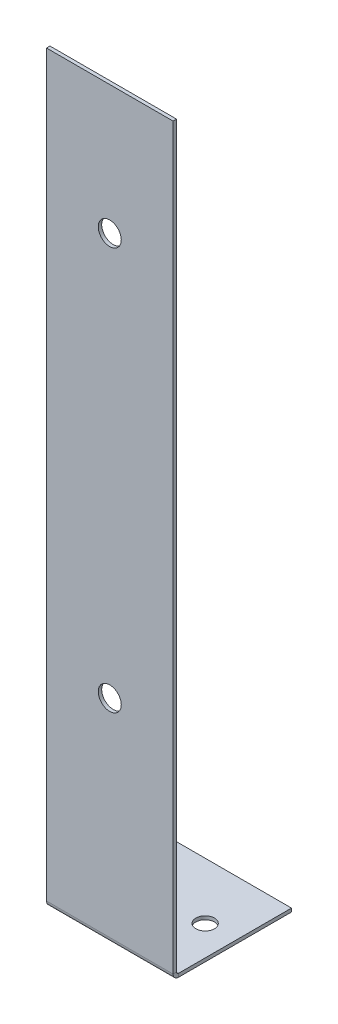
from build123d import *

# Parameters (mm, degrees)
SKETCH1_W              = 44
SKETCH1_H              = 300
BASE_FLANGE1_DEPTH     = 1.2
SKETCHED_START         = -22
SKETCHED_BEND1_DEPTH   = 44
SKETCHED_BEND1_2_DEPTH = 44
SKETCH7_R              = 4
CUT_EXTRUDE1_DEPTH     = 10
SKETCH9_R              = 3.234304459
CUT_EXTRUDE2_DEPTH     = 10


# Read off the part's stored shape, not the designer's step: Sketched Bend1
# Sheet-metal steps are written as plain solids
with BuildPart() as part:
    # Sketch1 → Base-Flange1 (new body)
    with BuildSketch(Plane(origin=(0, 0, 0), x_dir=(1, 0, 0), z_dir=(0, 1, 0))):
        Rectangle(SKETCH1_W, SKETCH1_H)
    extrude(amount=-BASE_FLANGE1_DEPTH)

    # Sketched Bend1 outline → Sketched Bend1 (cut)
    with BuildSketch(Plane.YZ.offset(SKETCHED_START)):
        with BuildLine():
            ThreePointArc((-1.2, -110.7366), (-0.872269031, -109.658657516), (0, -108.945555612))
            Line((0, -108.945555612), (0, 150))
            Line((0, 150), (-1.2, 150))
            Line((-1.2, 150), (-1.2, -110.7366))
        make_face()
    extrude(amount=SKETCHED_BEND1_DEPTH, mode=Mode.SUBTRACT)

    # Sketched Bend1 2 outline → Sketched Bend1 2 (add)
    with BuildSketch(Plane.YZ.offset(SKETCHED_START)):
        with BuildLine():
            Line((257.6, -110), (257.6, -108.8))
            Line((257.6, -108.8), (0.7366, -108.8))
            ThreePointArc((0.7366, -108.8), (0.361178238, -108.836737358), (0, -108.945555612))
            Line((0, -108.945555612), (0, -110.7366))
            ThreePointArc((0, -110.7366), (0.215745145, -110.215745145), (0.7366, -110))
            Line((0.7366, -110), (257.6, -110))
        make_face()
    extrude(amount=SKETCHED_BEND1_2_DEPTH)

    # Sketch7 → Cut-Extrude1 (cut)
    with BuildSketch(Plane.XY.offset(-108.8)):
        with Locations((0, 72.8)):
            Circle(SKETCH7_R)
        with Locations((0, 212.8)):
            Circle(SKETCH7_R)
    extrude(amount=-CUT_EXTRUDE1_DEPTH, mode=Mode.SUBTRACT)

    # Sketch9 → Cut-Extrude2 (cut)
    with BuildSketch(Plane.XZ.offset(1.2)):
        with Locations(Location((-11.601340887, -130.3683, 0), (0, 0, 270))):
            Circle(SKETCH9_R)
        with Locations(Location((11.601340887, -130.3683, 0), (0, 0, 270))):
            Circle(SKETCH9_R)
    extrude(amount=-CUT_EXTRUDE2_DEPTH, mode=Mode.SUBTRACT)


solid = part.part
